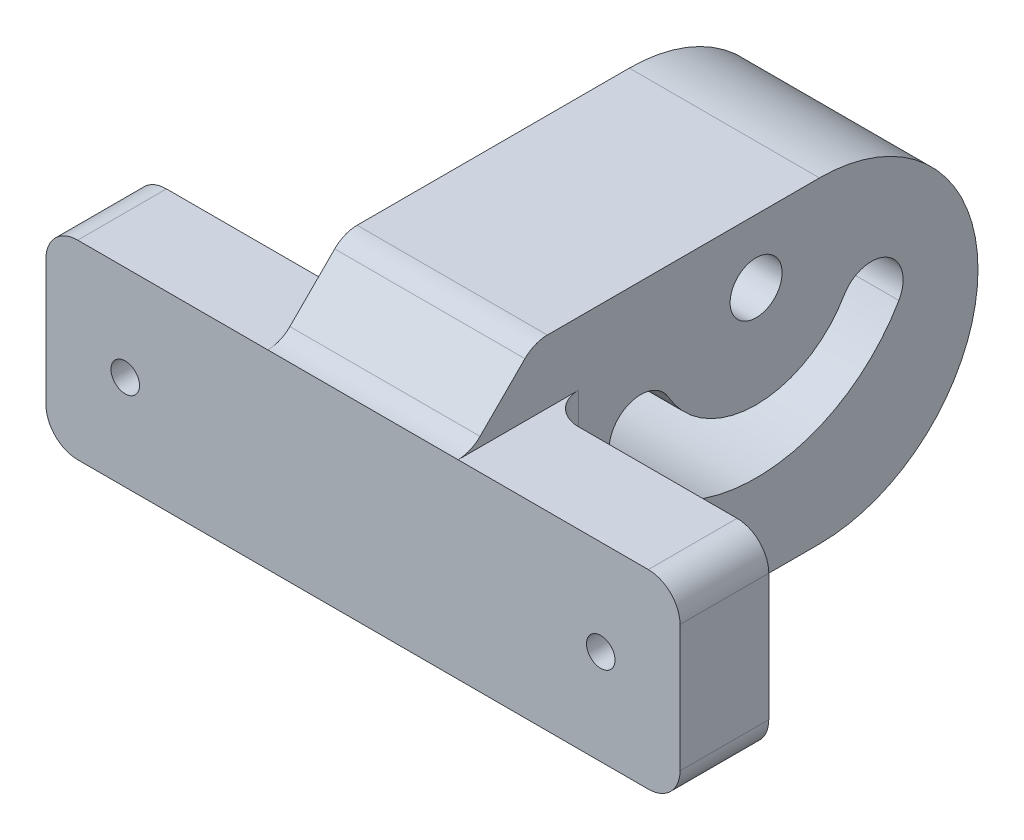
from build123d import *

# Parameters (mm, degrees)
SKETCH1_W               = 100
SKETCH1_H               = 30
BOSS_EXTRUDE1_DEPTH     = 14
SKETCH2_R               = 2.25
CUT_EXTRUDE1_DEPTH      = 14
SKETCH3_R               = 4.5
CUT_EXTRUDE2_DEPTH      = 4.4
BOSS_EXTRUDE2_DEPTH     = 15
CUT_EXTRUDE3_DEPTH      = 116.485929879
CUT_EXTRUDE3_DEPTH_BACK = 116.485929879
SKETCH6_R               = 4.1
FILLET1_R               = 25
CUT_EXTRUDE5_DEPTH      = 116.485929879
CUT_EXTRUDE5_DEPTH_BACK = 116.485929879
FILLET2_R               = 5


# Some blends are built 0.0001 mm under size
with BuildPart() as part:
    # Sketch1 → Boss-Extrude1 (new body)
    with BuildSketch(Plane(origin=(0, 0, -7), x_dir=(-1, 0, 0), z_dir=(0, 0, -1))):
        with Locations((0, -29)):
            Rectangle(SKETCH1_W, SKETCH1_H)
    extrude(amount=BOSS_EXTRUDE1_DEPTH)

    # Sketch2 → Cut-Extrude1 (cut)
    with BuildSketch(Plane(origin=(0, 0, -21), x_dir=(-1, 0, 0), z_dir=(0, 0, -1))):
        with Locations((-37.5, -29)):
            Circle(SKETCH2_R)
        with Locations((37.5, -29)):
            Circle(SKETCH2_R)
    extrude(amount=-CUT_EXTRUDE1_DEPTH, mode=Mode.SUBTRACT)

    # Sketch3 → Cut-Extrude2 (cut)
    with BuildSketch(Plane(origin=(0, 0, -21), x_dir=(-1, 0, 0), z_dir=(0, 0, -1))):
        with Locations((-37.5, -29)):
            Circle(SKETCH3_R)
        with Locations((37.5, -29)):
            Circle(SKETCH3_R)
    extrude(amount=-CUT_EXTRUDE2_DEPTH, mode=Mode.SUBTRACT)

    # Sketch5 → Boss-Extrude2 (add, symmetric)
    with BuildSketch(Plane(origin=(0, 0, 0), x_dir=(0, 0, -1), z_dir=(1, 0, 0))):
        Polygon((9, -14), (19, -4), (89, -4), (89, -54), (19, -54), (9, -44), align=None)
    extrude(amount=BOSS_EXTRUDE2_DEPTH, both=True)

    # Sketch6 → Cut-Extrude3 (cut, two sides: drawn at the far end of the back side and taken through both)
    with BuildSketch(Plane(origin=(0, 0, 0), x_dir=(0, 0, -1), z_dir=(1, 0, 0)).offset(-CUT_EXTRUDE3_DEPTH_BACK)):
        with Locations((54, -14)):
            Circle(SKETCH6_R)
    extrude(amount=CUT_EXTRUDE3_DEPTH + CUT_EXTRUDE3_DEPTH_BACK, mode=Mode.SUBTRACT)

    # Fillet1
    fillet1_edges = [part.edges().sort_by_distance(p)[0] for p in [
        (0, -4, -89),
        (0, -54, -89),
    ]]
    fillet(fillet1_edges, radius=FILLET1_R - 0.0001)  # a hair under: the kernel refuses the full size

    # Sketch7 → Cut-Extrude5 (cut, two sides: drawn at the far end of the back side and taken through both)
    with BuildSketch(Plane(origin=(0, 0, 0), x_dir=(0, 0, -1), z_dir=(1, 0, 0)).offset(-CUT_EXTRUDE5_DEPTH_BACK)):
        with BuildLine():
            ThreePointArc((31.483339502, -27), (54, -40), (76.516660498, -27))
            ThreePointArc((76.516660498, -27), (74.686533479, -20.169872981), (67.856406461, -22))
            ThreePointArc((67.856406461, -22), (54, -30), (40.143593539, -22))
            ThreePointArc((40.143593539, -22), (33.313466521, -20.169872981), (31.483339502, -27))
        make_face()
    extrude(amount=CUT_EXTRUDE5_DEPTH + CUT_EXTRUDE5_DEPTH_BACK, mode=Mode.SUBTRACT)

    # Fillet2
    # the kernel refuses this fillet: 5 mm, written as the material it adds along each edge
    with BuildSketch(Plane(origin=(-15, -14, -21), x_dir=(0, 0, -1), z_dir=(0, -1, 0))) as fillet2_piece_1:
        with BuildLine():
            CenterArc((FILLET2_R, -FILLET2_R), FILLET2_R, 90, 90)
            Line((0, -FILLET2_R), (0, 0))
            Line((0, 0), (FILLET2_R, 0))
        make_face()
    extrude(amount=30)
    with BuildSketch(Plane(origin=(15, -14, -21), x_dir=(0, 0, -1), z_dir=(0, -1, 0))) as fillet2_piece_2:
        with BuildLine():
            CenterArc((FILLET2_R, FILLET2_R), FILLET2_R, 180, 90)
            Line((0, FILLET2_R), (0, 0))
            Line((0, 0), (FILLET2_R, 0))
        make_face()
    extrude(amount=30)
    with BuildSketch(Plane(origin=(-15, -14, -9), x_dir=(0, 0.707106781186544, -0.7071067811865509), z_dir=(1, 0, 0))) as fillet2_piece_3_section:
        with BuildLine():
            CenterArc((FILLET2_R * 0.414213562373, FILLET2_R), FILLET2_R, 225, 45)
            Line((-FILLET2_R * 0.292893218813, FILLET2_R * 0.292893218813), (0, 0))
            Line((0, 0), (FILLET2_R * 0.414213562373, 0))
        make_face()
    fillet2_piece_3 = extrude(amount=30, mode=Mode.PRIVATE)
    fillet2_piece_3 = split(fillet2_piece_3, bisect_by=Plane(origin=(0, -13.688256851, -7), z_dir=(0, 0, -1)), keep=Keep.TOP, mode=Mode.PRIVATE)
    add(fillet2_piece_3)
    with BuildSketch(Plane(origin=(-15, -44, -9), x_dir=(0, -0.707106781186544, -0.7071067811865509), z_dir=(1, 0, 0))) as fillet2_piece_4_section:
        with BuildLine():
            CenterArc((FILLET2_R * 0.414213562373, -FILLET2_R), FILLET2_R, 90, 45)
            Line((-FILLET2_R * 0.292893218813, -FILLET2_R * 0.292893218813), (0, 0))
            Line((0, 0), (FILLET2_R * 0.414213562373, 0))
        make_face()
    fillet2_piece_4 = extrude(amount=30, mode=Mode.PRIVATE)
    fillet2_piece_4 = split(fillet2_piece_4, bisect_by=Plane(origin=(0, -44.311743149, -7), z_dir=(0, 0, -1)), keep=Keep.TOP, mode=Mode.PRIVATE)
    add(fillet2_piece_4)
    # the kernel refuses this fillet: 5 mm, written as the material it takes off along each edge
    with BuildSketch(Plane(origin=(-20.17766953, -54, -19), x_dir=(0, 0, -1), z_dir=(1, 0, 0))) as fillet2_2_piece_1:
        with BuildLine():
            CenterArc((FILLET2_R * 0.414213562373, FILLET2_R), FILLET2_R, 225, 45)
            Line((-FILLET2_R * 0.292893218813, FILLET2_R * 0.292893218813), (0, 0))
            Line((0, 0), (FILLET2_R * 0.414213562373, 0))
        make_face()
    extrude(amount=40.355339059, mode=Mode.SUBTRACT)
    with BuildSketch(Plane(origin=(20.17766953, -4, -19), x_dir=(0, -0.7071067811865441, 0.707106781186551), z_dir=(-1, 0, 0))) as fillet2_2_piece_2:
        with BuildLine():
            CenterArc((FILLET2_R * 0.414213562373, -FILLET2_R), FILLET2_R, 90, 45)
            Line((-FILLET2_R * 0.292893218813, -FILLET2_R * 0.292893218813), (0, 0))
            Line((0, 0), (FILLET2_R * 0.414213562373, 0))
        make_face()
    extrude(amount=40.355339059, mode=Mode.SUBTRACT)
    with BuildSketch(Plane(origin=(50, -14, 5.5), x_dir=(-1, 0, 0), z_dir=(0, 0, -1)), Plane(origin=(50, -44, 5.5), x_dir=(0, 1, 0), z_dir=(0, 0, -1))) as fillet2_2_piece_3:
        with BuildLine():
            CenterArc((FILLET2_R, -FILLET2_R), FILLET2_R, 90, 90)
            Line((0, -FILLET2_R), (0, 0))
            Line((0, 0), (FILLET2_R, 0))
        make_face()
    extrude(amount=39, mode=Mode.SUBTRACT)
    with BuildSketch(Plane(origin=(-50, -14, 5.5), x_dir=(1, 0, 0), z_dir=(0, 0, -1)), Plane(origin=(-50, -44, 5.5), x_dir=(0, 1, 0), z_dir=(0, 0, -1))) as fillet2_2_piece_4:
        with BuildLine():
            CenterArc((FILLET2_R, FILLET2_R), FILLET2_R, 180, 90)
            Line((0, FILLET2_R), (0, 0))
            Line((0, 0), (FILLET2_R, 0))
        make_face()
    extrude(amount=39, mode=Mode.SUBTRACT)


solid = part.part
